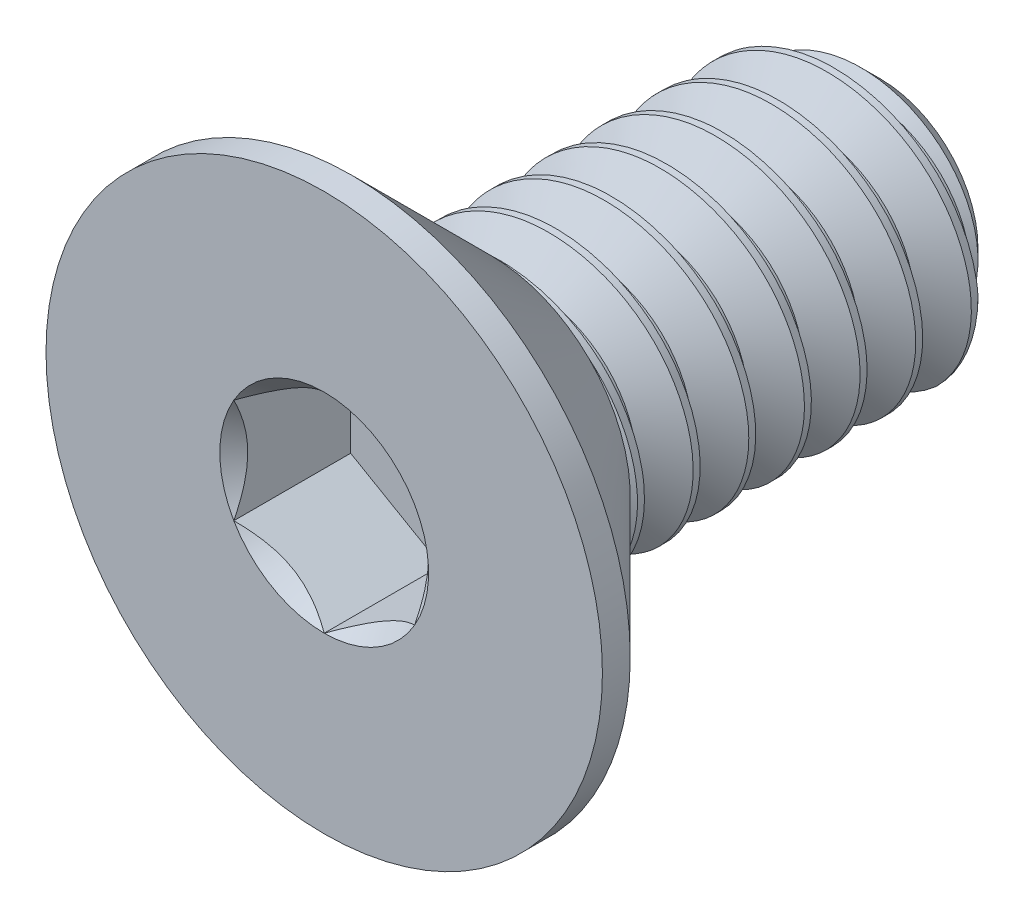
from build123d import *

# Parameters (mm, degrees)
SKETCH3_W          = 4
SKETCH3_H          = 1
CHAMFER1_SIZE      = 0.3
CUT_EXTRUDE1_DEPTH = 0.84
CUT_SWEEP1_PITCH   = 0.4


with BuildPart() as part:
    # Sketch3 → Revolve1 (revolve)
    with BuildSketch(Plane(origin=(0, 0, 0), x_dir=(0, 0, -1), z_dir=(1, 0, 0))):
        with Locations((0, 0.5)):
            Rectangle(SKETCH3_W, SKETCH3_H)
    revolve(axis=Axis((0, 0, -2), (0, 0, 1)))

    # Chamfer1
    chamfer1_edges = [part.edges().sort_by_distance(p)[0] for p in [
        (0, -1, -2),
    ]]
    chamfer(chamfer1_edges, length=CHAMFER1_SIZE)

    # Sketch6 → Revolve2 (revolve)
    with BuildSketch(Plane(origin=(0, 0, 0), x_dir=(0, 0, -1), z_dir=(1, 0, 0))):
        Polygon((-2, 2), (-1.8, 2), (-0.8, 1), (-0.8, 0), (-2, 0), align=None)
    revolve(axis=Axis((0, 0, -2), (0, 0, 1)))

    # Sketch8 → Cut-Extrude1 (cut)
    with BuildSketch(Plane.XY.offset(2)):
        Polygon((0, 0.75055535), (-0.65, 0.375277675), (-0.65, -0.375277675), (0, -0.75055535), (0.65, -0.375277675), (0.65, 0.375277675), align=None)
    extrude(amount=-CUT_EXTRUDE1_DEPTH, mode=Mode.SUBTRACT)

    # Cut-Extrude2 cone 1 section (through the dimple's axis) → Cut-Extrude2 (revolve, cut)
    with BuildSketch(Plane(origin=(0, 0, 2), x_dir=(0, -1, 0), z_dir=(1, 0, 0))):
        Polygon((0, 0), (0.75055535, 0), (0, 0.75055535), align=None)
    revolve(axis=Axis((0, 0, 2), (0, 0, -1)), mode=Mode.SUBTRACT)


with BuildPart() as body_2:
    # Split1: the piece on the far side of the plane
    add(part.part)
    split(bisect_by=Plane.XY.offset(0.8), keep=Keep.BOTTOM)

    # Cut-Sweep1: the profile of Sketch10 screwed along a right-hand helix of 10 turns, 6 arcs to a turn; built about Z, then put on its axis
    cut_sweep1_z = Axis((0, 0, 0), (0, 0, 1))
    cut_sweep1_corners = [(1.021650635, 0, 0.0125), (1.021650635, 0, -0.3625), (0.740192379, 0, -0.2), (0.740192379, 0, -0.15)]
    with BuildLine(mode=Mode.PRIVATE) as cut_sweep1_profile:
        Line(cut_sweep1_corners[0], cut_sweep1_corners[1])
        Line(cut_sweep1_corners[1], cut_sweep1_corners[2])
        Line(cut_sweep1_corners[2], cut_sweep1_corners[3])
        Line(cut_sweep1_corners[3], cut_sweep1_corners[0])
    cut_sweep1_cap = Face(cut_sweep1_profile.wire())
    cut_sweep1_turn_angles = [0, 30, 60, 90, 120, 150, 180, 210, 240, 270, 300, 330, 360]
    cut_sweep1_turn_weights = [1, 0.8660254037844387, 1, 0.8660254037844387, 1, 0.8660254037844387, 1, 0.8660254037844387, 1, 0.8660254037844387, 1, 0.8660254037844387, 1]
    cut_sweep1_turn_rails = [Edge.make_bspline([Vector(p[0], p[1], 0).rotate(cut_sweep1_z, cut_sweep1_turn_angles[k]) / cut_sweep1_turn_weights[k] + Vector(0, 0, p[2] + CUT_SWEEP1_PITCH * cut_sweep1_turn_angles[k] / 360) for k in range(13)], [0, 0, 0, 1, 1, 2, 2, 3, 3, 4, 4, 5, 5, 6, 6, 6], 2, cut_sweep1_turn_weights) for p in cut_sweep1_corners]
    cut_sweep1_turn_sides = [Face.make_surface_from_curves(cut_sweep1_turn_rails[p[0]], cut_sweep1_turn_rails[p[1]]) for p in [(0, 1), (1, 2), (2, 3), (3, 0)]]
    cut_sweep1_turn = Solid(Shell([*cut_sweep1_turn_sides, cut_sweep1_cap, cut_sweep1_cap.rotate(cut_sweep1_z, 360).moved(Location((0, 0, CUT_SWEEP1_PITCH * 360 / 360)))]))
    cut_sweep1_each = [*[cut_sweep1_turn.moved(Location((0, 0, CUT_SWEEP1_PITCH * i))) for i in range(10)]]
    add(Plane(origin=(0, 0, -2), x_dir=(0, 1, 0), z_dir=(0, 0, 1)) * Compound([cut_sweep1_each[i] for i in range(0, 10, 2)]), mode=Mode.SUBTRACT)
    add(Plane(origin=(0, 0, -2), x_dir=(0, 1, 0), z_dir=(0, 0, 1)) * Compound([cut_sweep1_each[i] for i in range(1, 10, 2)]), mode=Mode.SUBTRACT)


with BuildPart() as part_1:
    add(part.part)

    # Split1
    split(bisect_by=Plane.XY.offset(0.8), keep=Keep.TOP)


with BuildPart() as body_2_1:
    add(body_2.part)

    # Combine1: union part
    add(part_1.part)


solid = body_2_1.part
